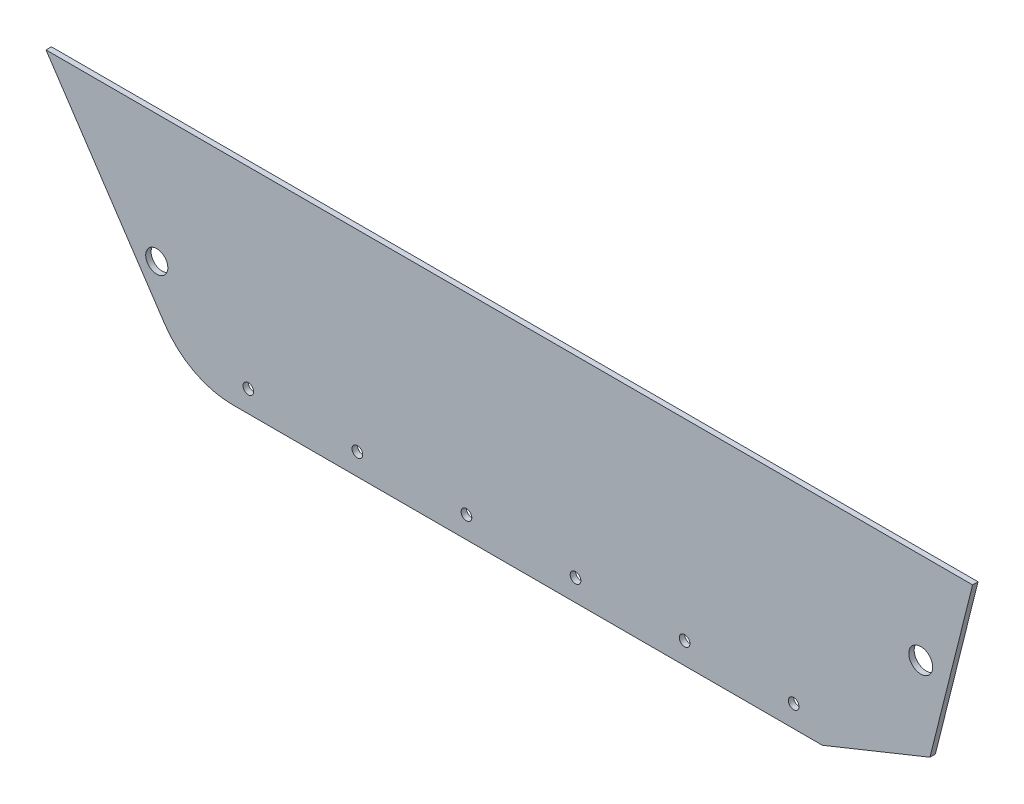
from build123d import *

# Parameters (mm, degrees)
BOSS_EXTRUDE1_DEPTH = 3.175
SKETCH1_4_R         = 3.125
CUT_EXTRUDE1_DEPTH  = 439.905857431
FILLET1_R           = 48
CUT_EXTRUDE3_DEPTH  = 10
CUT_EXTRUDE5_REACH  = 440.906
SKETCH11_R          = 7
SKETCH13_R          = 6.5
CUT_EXTRUDE6_DEPTH  = 10


with BuildPart() as part:
    # Sketch1 → Boss-Extrude1 (new body)
    with BuildSketch(Plane.XY):
        Polygon((-98.879411765, 3.850980392), (-31.879411765, -96.649019608), (366, -96.649019608), (403.120588235, -71.149019608), (428.120588235, 28.939617947), (-115.605170134, 28.939617947), align=None)
    extrude(amount=BOSS_EXTRUDE1_DEPTH)

    # Sketch1<4> → Cut-Extrude1 (cut, through all)
    with BuildSketch(Plane.XY):
        with Locations((3.120588235, -83.899019608)):
            Circle(SKETCH1_4_R)
        with Locations((67.120588235, -83.899019608)):
            Circle(SKETCH1_4_R)
        with Locations((131.120588235, -83.899019608)):
            Circle(SKETCH1_4_R)
        with Locations((195.120588235, -83.899019608)):
            Circle(SKETCH1_4_R)
        with Locations((259.120588235, -83.899019608)):
            Circle(SKETCH1_4_R)
        with Locations((323.120588235, -83.899019608)):
            Circle(SKETCH1_4_R)
    extrude(amount=CUT_EXTRUDE1_DEPTH, mode=Mode.SUBTRACT)

    # Fillet1
    fillet1_edges = [part.edges().sort_by_distance(p)[0] for p in [
        (-31.879411765, -96.649019608, 1.5875),
    ]]
    fillet(fillet1_edges, radius=FILLET1_R)

    # Sketch7 → Cut-Extrude3 (cut)
    with BuildSketch(Plane.XY.offset(3.175)):
        Polygon((403.120588235, -71.149019608), (340.005873473, -96.649019608), (366, -96.649019608), align=None)
    extrude(amount=-CUT_EXTRUDE3_DEPTH, mode=Mode.SUBTRACT)

    # Sketch11 → Cut-Extrude5 (cut, up to next)
    with BuildSketch(Plane(origin=(0, 0, 0), x_dir=(-1, 0, 0), z_dir=(0, 0, -1)), mode=Mode.PRIVATE) as cut_extrude5_sk1:
        with Locations((-397.678558137, -24.610405219)):
            Circle(SKETCH11_R)
    cut_extrude5_tool1 = extrude(cut_extrude5_sk1.sketch, amount=-CUT_EXTRUDE5_REACH, mode=Mode.PRIVATE) & part.part
    add(cut_extrude5_tool1.solids().sort_by_distance((397.678558, -24.610405, 0))[0], mode=Mode.SUBTRACT)

    # Sketch13 → Cut-Extrude6 (cut)
    with BuildSketch(Plane(origin=(0, 0, 0), x_dir=(-1, 0, 0), z_dir=(0, 0, -1))):
        with Locations((50.605170134, -46.060382053)):
            Circle(SKETCH13_R)
    extrude(amount=-CUT_EXTRUDE6_DEPTH, mode=Mode.SUBTRACT)


solid = part.part
